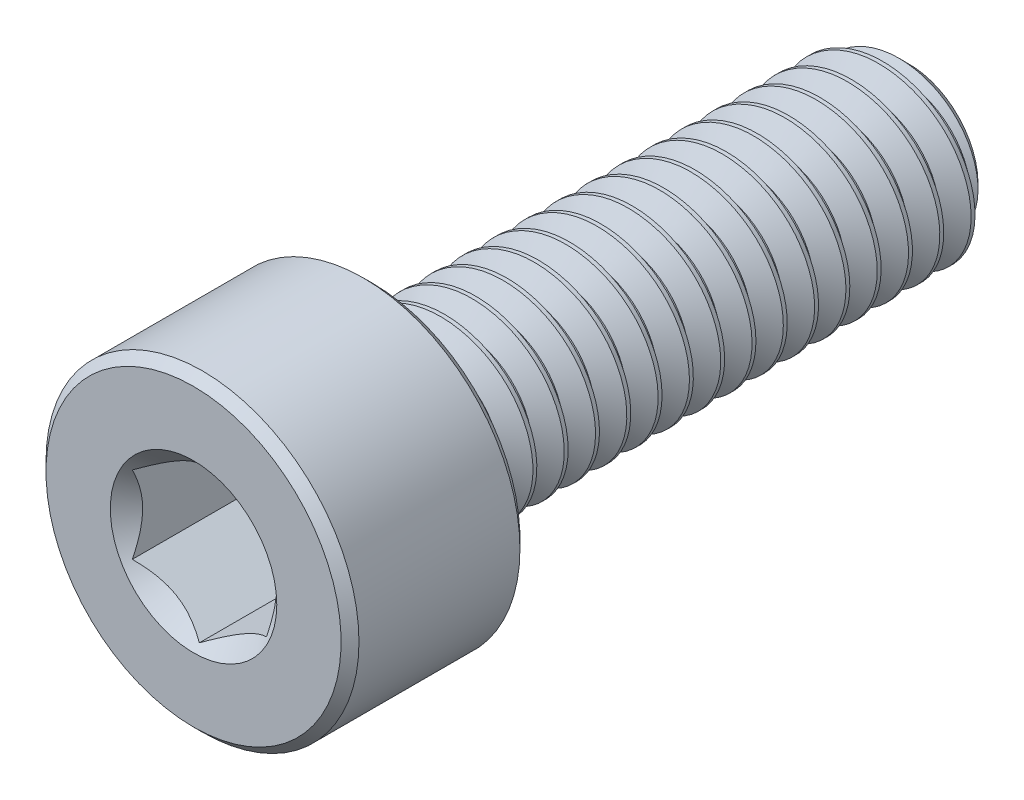
from build123d import *

# Parameters (mm, degrees)
CUT_EXTRUDE1_DEPTH     = 3
SPLIT1_SURFACE_1_BACK  = 19.815
SPLIT1_SURFACE_1_DEPTH = 39.63
SPLIT1_SURFACE_2_BACK  = 19.815
SPLIT1_SURFACE_2_DEPTH = 39.63
CUT_SWEEP1_PITCH       = 0.7


with BuildPart() as part:
    # Sketch2 → Revolve1 (revolve)
    with BuildSketch(Plane(origin=(0, 0, 0), x_dir=(0, 0, -1), z_dir=(1, 0, 0))):
        with BuildLine():
            Line((-8, 0), (-8, 3.3))
            Line((-8, 3.3), (-7.8, 3.5))
            Line((-7.8, 3.5), (-4.2, 3.5))
            Line((-4.2, 3.5), (-4, 3.3))
            Line((-4, 3.3), (-4, 2.2))
            ThreePointArc((-4, 2.2), (-3.941421356, 2.058578644), (-3.8, 2))
            Line((-3.8, 2), (7.545336663, 2))
            Line((7.545336663, 2), (8, 1.545336663))
            Line((8, 1.545336663), (8, 0))
            Line((8, 0), (-8, 0))
        make_face()
    revolve(axis=Axis((0, 0, -8), (0, 0, 1)))

    # Sketch3 → Cut-Extrude1 (cut)
    with BuildSketch(Plane.XY.offset(8)):
        Polygon((1.5, -0.866025404), (1.5, 0.866025404), (0, 1.732050808), (-1.5, 0.866025404), (-1.5, -0.866025404), (0, -1.732050808), align=None)
    extrude(amount=-CUT_EXTRUDE1_DEPTH, mode=Mode.SUBTRACT)

    # Cut-Extrude2 cone 1 section (through the dimple's axis) → Cut-Extrude2 (revolve, cut)
    with BuildSketch(Plane(origin=(0, 0, 8), x_dir=(0, -1, 0), z_dir=(1, 0, 0))):
        Polygon((0, 0), (1.861954618, 0), (0, 1.861954618), align=None)
    revolve(axis=Axis((0, 0, 8), (0, 0, -1)), mode=Mode.SUBTRACT)


with BuildPart() as body_2:
    # Split1: the piece behind the surface
    add(part.part)
    # Split1 surface: a surface, the sketch's curves swept straight by 39.63 mm
    with BuildLine(Plane(origin=(0, 0, 0), x_dir=(0, 0, -1), z_dir=(1, 0, 0)).offset(-SPLIT1_SURFACE_1_BACK), mode=Mode.PRIVATE) as split1_surface_1_path:
        Line((-3.8, -3.5), (-3.8, 3.5))
    split1_surface_1 = Shell.extrude(split1_surface_1_path.wire(), (1 * SPLIT1_SURFACE_1_DEPTH, 0 * SPLIT1_SURFACE_1_DEPTH, 0 * SPLIT1_SURFACE_1_DEPTH))
    split(bisect_by=split1_surface_1, keep=Keep.BOTTOM)

    # Cut-Sweep1: the profile of Sketch7 screwed along a right-hand helix of 18.142857 turns, 6 arcs to a turn; built about Z, then put on its axis
    cut_sweep1_z = Axis((0, 0, 0), (0, 0, 1))
    cut_sweep1_corners = [(2.037888611, 0, 0.021875), (2.037888611, 0, -0.634375), (1.545336663, 0, -0.35), (1.545336663, 0, -0.2625)]
    with BuildLine(mode=Mode.PRIVATE) as cut_sweep1_profile:
        Line(cut_sweep1_corners[0], cut_sweep1_corners[1])
        Line(cut_sweep1_corners[1], cut_sweep1_corners[2])
        Line(cut_sweep1_corners[2], cut_sweep1_corners[3])
        Line(cut_sweep1_corners[3], cut_sweep1_corners[0])
    cut_sweep1_cap = Face(cut_sweep1_profile.wire())
    cut_sweep1_turn_angles = [0, 30, 60, 90, 120, 150, 180, 210, 240, 270, 300, 330, 360]
    cut_sweep1_turn_weights = [1, 0.8660254037844387, 1, 0.8660254037844387, 1, 0.8660254037844387, 1, 0.8660254037844387, 1, 0.8660254037844387, 1, 0.8660254037844387, 1]
    cut_sweep1_turn_rails = [Edge.make_bspline([Vector(p[0], p[1], 0).rotate(cut_sweep1_z, cut_sweep1_turn_angles[k]) / cut_sweep1_turn_weights[k] + Vector(0, 0, p[2] + CUT_SWEEP1_PITCH * cut_sweep1_turn_angles[k] / 360) for k in range(13)], [0, 0, 0, 1, 1, 2, 2, 3, 3, 4, 4, 5, 5, 6, 6, 6], 2, cut_sweep1_turn_weights) for p in cut_sweep1_corners]
    cut_sweep1_turn_sides = [Face.make_surface_from_curves(cut_sweep1_turn_rails[p[0]], cut_sweep1_turn_rails[p[1]]) for p in [(0, 1), (1, 2), (2, 3), (3, 0)]]
    cut_sweep1_turn = Solid(Shell([*cut_sweep1_turn_sides, cut_sweep1_cap, cut_sweep1_cap.rotate(cut_sweep1_z, 360).moved(Location((0, 0, CUT_SWEEP1_PITCH * 360 / 360)))]))
    cut_sweep1_last_angles = [6480, 6505.714285714, 6531.428571429]
    cut_sweep1_last_weights = [1, 0.9009688679026391, 1]
    cut_sweep1_last_rails = [Edge.make_bspline([Vector(p[0], p[1], 0).rotate(cut_sweep1_z, cut_sweep1_last_angles[k]) / cut_sweep1_last_weights[k] + Vector(0, 0, p[2] + CUT_SWEEP1_PITCH * cut_sweep1_last_angles[k] / 360) for k in range(3)], [0, 0, 0, 1, 1, 1], 2, cut_sweep1_last_weights) for p in cut_sweep1_corners]
    cut_sweep1_last_sides = [Face.make_surface_from_curves(cut_sweep1_last_rails[p[0]], cut_sweep1_last_rails[p[1]]) for p in [(0, 1), (1, 2), (2, 3), (3, 0)]]
    cut_sweep1_last = Solid(Shell([*cut_sweep1_last_sides, cut_sweep1_cap.rotate(cut_sweep1_z, 6480).moved(Location((0, 0, CUT_SWEEP1_PITCH * 6480 / 360))), cut_sweep1_cap.rotate(cut_sweep1_z, 6531.428571429).moved(Location((0, 0, CUT_SWEEP1_PITCH * 6531.428571429 / 360)))]))
    cut_sweep1_each = [*[cut_sweep1_turn.moved(Location((0, 0, CUT_SWEEP1_PITCH * i))) for i in range(18)], cut_sweep1_last]
    add(Plane(origin=(0, 0, -8), x_dir=(0, 1, 0), z_dir=(0, 0, 1)) * Compound([cut_sweep1_each[i] for i in range(0, 19, 2)]), mode=Mode.SUBTRACT)
    add(Plane(origin=(0, 0, -8), x_dir=(0, 1, 0), z_dir=(0, 0, 1)) * Compound([cut_sweep1_each[i] for i in range(1, 19, 2)]), mode=Mode.SUBTRACT)


with BuildPart() as part_1:
    add(part.part)

    # Split1: split by a surface, the side it looks to stays
    # Split1 surface: a surface, the sketch's curves swept straight by 39.63 mm
    with BuildLine(Plane(origin=(0, 0, 0), x_dir=(0, 0, -1), z_dir=(1, 0, 0)).offset(-SPLIT1_SURFACE_2_BACK), mode=Mode.PRIVATE) as split1_surface_2_path:
        Line((-3.8, -3.5), (-3.8, 3.5))
    split1_surface_2 = Shell.extrude(split1_surface_2_path.wire(), (1 * SPLIT1_SURFACE_2_DEPTH, 0 * SPLIT1_SURFACE_2_DEPTH, 0 * SPLIT1_SURFACE_2_DEPTH))
    split(bisect_by=split1_surface_2, keep=Keep.TOP)

    add(body_2.part)  # Revolve2 merges body 2
    # Sketch8 → Revolve2 (revolve)
    with BuildSketch(Plane(origin=(0, 0, 0), x_dir=(0, 0, -1), z_dir=(1, 0, 0)), mode=Mode.PRIVATE) as revolve2_sk:
        Polygon((-4, 0), (-4, 2), (-3.8, 2), (-2.645299462, 0), align=None)
    revolve(revolve2_sk.sketch.rotate(Axis((0, 0, 2.645299462), (0, 0, 1)), 270), axis=Axis((0, 0, 2.645299462), (0, 0, 1)))


solid = part_1.part
